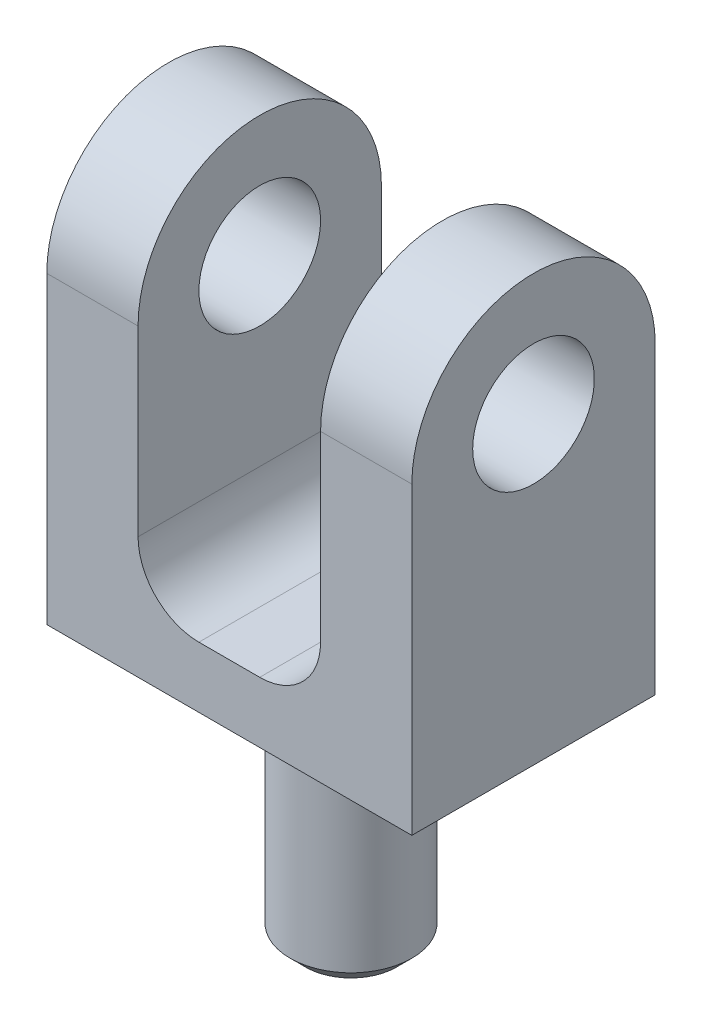
from build123d import *

# Parameters (mm, degrees)
SKETCH1_R               = 3.175
BOSS_EXTRUDE1_DEPTH     = 9.525
SKETCH2_R               = 3.175
BOSS_EXTRUDE2_DEPTH     = 12.7
CHAMFER1_SIZE           = 0.79375
CUT_EXTRUDE1_DEPTH      = 31.782767095
CUT_EXTRUDE1_DEPTH_BACK = 31.782767095
SKETCH3_W               = 9.525
SKETCH3_H               = 19.05
FILLET1_R               = 3.175


with BuildPart() as part:
    # Sketch1 → Boss-Extrude1 (new, symmetric)
    with BuildSketch(Plane(origin=(0, 0, 0), x_dir=(0, 0, -1), z_dir=(1, 0, 0))):
        with BuildLine():
            Line((-6.35, 0), (-6.35, -15.875))
            Line((-6.35, -15.875), (6.35, -15.875))
            Line((6.35, -15.875), (6.35, 0))
            ThreePointArc((6.35, 0), (0, 6.35), (-6.35, 0))
        make_face()
        Circle(SKETCH1_R, mode=Mode.SUBTRACT)
    extrude(amount=BOSS_EXTRUDE1_DEPTH, both=True)

    # Sketch2 → Boss-Extrude2 (add)
    with BuildSketch(Plane.XZ.offset(15.875)):
        Circle(SKETCH2_R)
    extrude(amount=BOSS_EXTRUDE2_DEPTH)

    # Chamfer1
    chamfer1_edges = [part.edges().sort_by_distance(p)[0] for p in [
        (-3.175, -28.575, 0),
    ]]
    chamfer(chamfer1_edges, length=CHAMFER1_SIZE)

    # Sketch3 → Cut-Extrude1 (cut, two sides: drawn at the far end of the back side and taken through both)
    with BuildSketch(Plane.XY.offset(-CUT_EXTRUDE1_DEPTH_BACK)):
        with Locations((0, -3.175)):
            Rectangle(SKETCH3_W, SKETCH3_H)
    extrude(amount=CUT_EXTRUDE1_DEPTH + CUT_EXTRUDE1_DEPTH_BACK, mode=Mode.SUBTRACT)

    # Fillet1
    fillet1_edges = [part.edges().sort_by_distance(p)[0] for p in [
        (-4.7625, -12.7, 0),
        (4.7625, -12.7, 0),
    ]]
    fillet(fillet1_edges, radius=FILLET1_R)


solid = part.part
